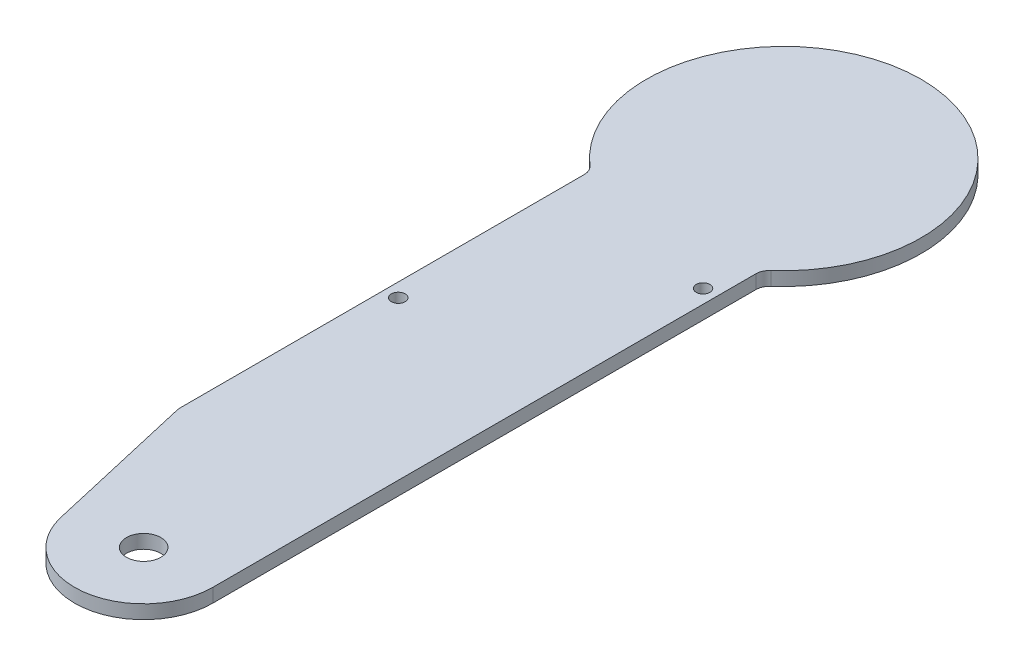
from build123d import *

# Parameters (mm, degrees)
SKETCH1_R           = 3.175
SKETCH1_R_2         = 1.27
BOSS_EXTRUDE1_DEPTH = 2.54
FILLET1_R           = 2.54


with BuildPart() as part:
    # Sketch1 → Boss-Extrude1 (new body)
    with BuildSketch(Plane(origin=(0, 0, 0), x_dir=(1, 0, 0), z_dir=(0, 1, 0))):
        with BuildLine():
            Line((-15.875, -19.827868645), (-15.875, -96.027868645))
            Line((-15.875, -96.027868645), (-9.362396438, -124.297332186))
            ThreePointArc((-9.362396438, -124.297332186), (4.537150087, -134.127868645), (15.875, -121.427868645))
            Line((15.875, -121.427868645), (15.875, -96.027868645))
            Line((15.875, -96.027868645), (15.875, -19.827868645))
            ThreePointArc((15.875, -19.827868645), (0, 25.4), (-15.875, -19.827868645))
        make_face()
        with Locations((3.093174395, -121.427868645)):
            Circle(SKETCH1_R, mode=Mode.SUBTRACT)
        with Locations((-13.335, -57.927868645)):
            Circle(SKETCH1_R_2, mode=Mode.SUBTRACT)
        with Locations((13.335, -28.25059986)):
            Circle(SKETCH1_R_2, mode=Mode.SUBTRACT)
    extrude(amount=BOSS_EXTRUDE1_DEPTH)

    # Fillet1
    fillet1_edges = [part.edges().sort_by_distance(p)[0] for p in [
        (-15.875, 1.27, 96.027868645),
        (-15.875, 1.27, 19.827868645),
        (15.875, 1.27, 19.827868645),
    ]]
    fillet(fillet1_edges, radius=FILLET1_R)


solid = part.part
